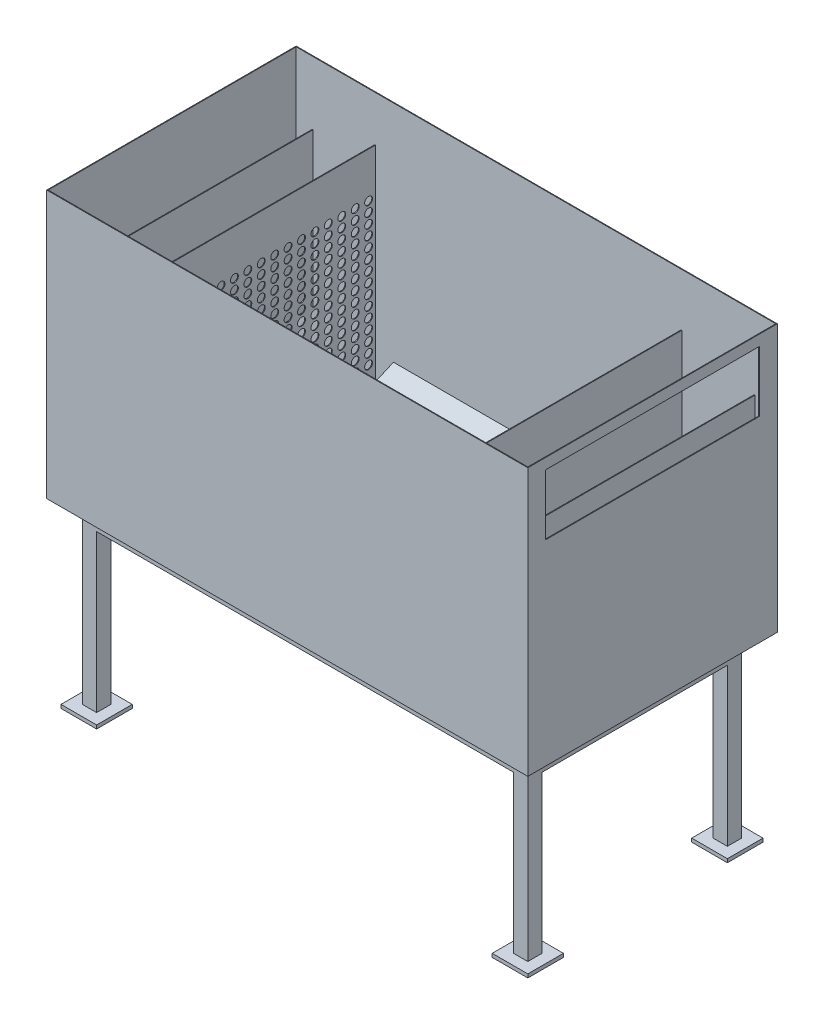
from build123d import *

# Parameters (mm, degrees)
MASTER_FOOTPRINT_W             = 1350
MASTER_FOOTPRINT_H             = 700
BATH_BASE_PLATE_DEPTH          = 750
BATH_SHELL_2MM_T               = -2
SKETCH_1_R                     = 50
INLET_D100_OPENING_DEPTH       = 10
INLET_IMPACT_BAFFLE_START      = 125
SKETCH_2_W                     = 540
SKETCH_2_H                     = 430
INLET_IMPACT_BAFFLE_DEPTH      = 2
DISTRIBUTOR_D22_START          = 250
SKETCH_3_W                     = 640
SKETCH_3_H                     = 648
SKETCH_3_R                     = 11
DISTRIBUTOR_D22_DEPTH          = 2
OUTLET_SUBMERGED_BAFFLE_START  = 1130
SKETCH_4_W                     = 600
SKETCH_4_H                     = 330
OUTLET_SUBMERGED_BAFFLE_DEPTH  = 2
OVERFLOW_WEIR_Z550_START       = 1290
SKETCH_5_W                     = 690
SKETCH_5_H                     = 548
OVERFLOW_WEIR_Z550_DEPTH       = 2
OUTLET_WEIR_SLOT_W600_START    = 1345
SKETCH_6_W                     = 600
SKETCH_6_H                     = 170
OUTLET_WEIR_SLOT_W600_DEPTH    = 10
SLOPED_SEDIMENT_FLOOR_START    = 275
SLOPED_SEDIMENT_FLOOR_DEPTH    = 825
SKETCH_8_W                     = 40
SKETCH_8_H                     = 40
FRAME_LEGS_40X40_H500_DEPTH    = 500
FRAME_LONGITUDINAL_RAILS_START = -20
SKETCH_9_W                     = 1250
SKETCH_9_H                     = 40
FRAME_LONGITUDINAL_RAILS_DEPTH = 40
FRAME_TRANSVERSE_RAILS_START   = -20
SKETCH_10_W                    = 40
SKETCH_10_H                    = 520
FRAME_TRANSVERSE_RAILS_DEPTH   = 40
FRAME_FOOT_PADS_100X100_START  = -500
SKETCH_11_W                    = 100
SKETCH_11_H                    = 100
FRAME_FOOT_PADS_100X100_DEPTH  = 10


with BuildPart() as part:
    # MASTER_FOOTPRINT → BATH_BASE_PLATE (new body)
    with BuildSketch(Plane(origin=(0, 0, 0), x_dir=(1, 0, 0), z_dir=(0, 1, 0))):
        with Locations((675, 350)):
            Rectangle(MASTER_FOOTPRINT_W, MASTER_FOOTPRINT_H)
    extrude(amount=BATH_BASE_PLATE_DEPTH)

    # BATH_SHELL_2MM
    bath_shell_2mm_openings = [part.faces().sort_by_distance(p)[0] for p in [
        (675, 750, -350),
    ]]
    offset(amount=BATH_SHELL_2MM_T, openings=bath_shell_2mm_openings, kind=Kind.INTERSECTION)

    # Эскиз1 → INLET_D100_OPENING (cut)
    with BuildSketch(Plane(origin=(0, 0, 0), x_dir=(0, 0, -1), z_dir=(1, 0, 0))):
        with Locations((350, 420)):
            Circle(SKETCH_1_R)
    extrude(amount=INLET_D100_OPENING_DEPTH, mode=Mode.SUBTRACT)

    # Эскиз6 → OUTLET_WEIR_SLOT_W600 (cut)
    with BuildSketch(Plane(origin=(0, 0, 0), x_dir=(0, 0, -1), z_dir=(1, 0, 0)).offset(OUTLET_WEIR_SLOT_W600_START)):
        with Locations((350, 635)):
            Rectangle(SKETCH_6_W, SKETCH_6_H)
    extrude(amount=OUTLET_WEIR_SLOT_W600_DEPTH, mode=Mode.SUBTRACT)

    # Эскиз7 → SLOPED_SEDIMENT_FLOOR (add)
    with BuildSketch(Plane(origin=(0, 0, 0), x_dir=(0, 0, -1), z_dir=(1, 0, 0)).offset(SLOPED_SEDIMENT_FLOOR_START)):
        Polygon((2, -1), (2, 120), (280, -1), align=None)
        Polygon((698, -1), (698, 120), (420, -1), align=None)
    extrude(amount=SLOPED_SEDIMENT_FLOOR_DEPTH)

    # Эскиз8 → FRAME_LEGS_40X40_H500 (add)
    with BuildSketch(Plane(origin=(0, 0, 0), x_dir=(1, 0, 0), z_dir=(0, 1, 0))):
        with Locations((70, 70)):
            Rectangle(SKETCH_8_W, SKETCH_8_H)
        with Locations((70, 630)):
            Rectangle(SKETCH_8_W, SKETCH_8_H)
        with Locations((1280, 70)):
            Rectangle(SKETCH_8_W, SKETCH_8_H)
        with Locations((1280, 630)):
            Rectangle(SKETCH_8_W, SKETCH_8_H)
    extrude(amount=-FRAME_LEGS_40X40_H500_DEPTH)

    # Эскиз9 → FRAME_LONGITUDINAL_RAILS (add)
    with BuildSketch(Plane(origin=(0, 0, 0), x_dir=(1, 0, 0), z_dir=(0, 1, 0)).offset(FRAME_LONGITUDINAL_RAILS_START)):
        with Locations((675, 70)):
            Rectangle(SKETCH_9_W, SKETCH_9_H)
        with Locations((675, 630)):
            Rectangle(SKETCH_9_W, SKETCH_9_H)
    extrude(amount=-FRAME_LONGITUDINAL_RAILS_DEPTH)

    # Эскиз10 → FRAME_TRANSVERSE_RAILS (add)
    with BuildSketch(Plane(origin=(0, 0, 0), x_dir=(1, 0, 0), z_dir=(0, 1, 0)).offset(FRAME_TRANSVERSE_RAILS_START)):
        with Locations((70, 350)):
            Rectangle(SKETCH_10_W, SKETCH_10_H)
        with Locations((1280, 350)):
            Rectangle(SKETCH_10_W, SKETCH_10_H)
    extrude(amount=-FRAME_TRANSVERSE_RAILS_DEPTH)

    # Эскиз11 → FRAME_FOOT_PADS_100X100 (add)
    with BuildSketch(Plane(origin=(0, 0, 0), x_dir=(1, 0, 0), z_dir=(0, 1, 0)).offset(FRAME_FOOT_PADS_100X100_START)):
        with Locations((70, 70)):
            Rectangle(SKETCH_11_W, SKETCH_11_H)
        with Locations((70, 630)):
            Rectangle(SKETCH_11_W, SKETCH_11_H)
        with Locations((1280, 70)):
            Rectangle(SKETCH_11_W, SKETCH_11_H)
        with Locations((1280, 630)):
            Rectangle(SKETCH_11_W, SKETCH_11_H)
    extrude(amount=-FRAME_FOOT_PADS_100X100_DEPTH)


with BuildPart() as body_2:
    # Эскиз2 → INLET_IMPACT_BAFFLE (new body)
    with BuildSketch(Plane(origin=(0, 0, 0), x_dir=(0, 0, -1), z_dir=(1, 0, 0)).offset(INLET_IMPACT_BAFFLE_START)):
        with Locations((350, 435)):
            Rectangle(SKETCH_2_W, SKETCH_2_H)
    extrude(amount=INLET_IMPACT_BAFFLE_DEPTH)


with BuildPart() as body_3:
    # Эскиз3 → DISTRIBUTOR_D22 (new body)
    with BuildSketch(Plane(origin=(0, 0, 0), x_dir=(0, 0, -1), z_dir=(1, 0, 0)).offset(DISTRIBUTOR_D22_START)):
        with Locations((350, 326)):
            Rectangle(SKETCH_3_W, SKETCH_3_H)
        with Locations((48.823529412, 125)):
            Circle(SKETCH_3_R, mode=Mode.SUBTRACT)
        with Locations((48.823529412, 153.5)):
            Circle(SKETCH_3_R, mode=Mode.SUBTRACT)
        with Locations((48.823529412, 182)):
            Circle(SKETCH_3_R, mode=Mode.SUBTRACT)
        with Locations((48.823529412, 210.5)):
            Circle(SKETCH_3_R, mode=Mode.SUBTRACT)
        with Locations((48.823529412, 239)):
            Circle(SKETCH_3_R, mode=Mode.SUBTRACT)
        with Locations((48.823529412, 267.5)):
            Circle(SKETCH_3_R, mode=Mode.SUBTRACT)
        with Locations((48.823529412, 296)):
            Circle(SKETCH_3_R, mode=Mode.SUBTRACT)
        with Locations((48.823529412, 324.5)):
            Circle(SKETCH_3_R, mode=Mode.SUBTRACT)
        with Locations((48.823529412, 353)):
            Circle(SKETCH_3_R, mode=Mode.SUBTRACT)
        with Locations((48.823529412, 381.5)):
            Circle(SKETCH_3_R, mode=Mode.SUBTRACT)
        with Locations((48.823529412, 410)):
            Circle(SKETCH_3_R, mode=Mode.SUBTRACT)
        with Locations((48.823529412, 438.5)):
            Circle(SKETCH_3_R, mode=Mode.SUBTRACT)
        with Locations((48.823529412, 467)):
            Circle(SKETCH_3_R, mode=Mode.SUBTRACT)
        with Locations((48.823529412, 495.5)):
            Circle(SKETCH_3_R, mode=Mode.SUBTRACT)
        with Locations((48.823529412, 524)):
            Circle(SKETCH_3_R, mode=Mode.SUBTRACT)
        with Locations((86.470588235, 125)):
            Circle(SKETCH_3_R, mode=Mode.SUBTRACT)
        with Locations((86.470588235, 153.5)):
            Circle(SKETCH_3_R, mode=Mode.SUBTRACT)
        with Locations((86.470588235, 182)):
            Circle(SKETCH_3_R, mode=Mode.SUBTRACT)
        with Locations((86.470588235, 210.5)):
            Circle(SKETCH_3_R, mode=Mode.SUBTRACT)
        with Locations((86.470588235, 239)):
            Circle(SKETCH_3_R, mode=Mode.SUBTRACT)
        with Locations((86.470588235, 267.5)):
            Circle(SKETCH_3_R, mode=Mode.SUBTRACT)
        with Locations((86.470588235, 296)):
            Circle(SKETCH_3_R, mode=Mode.SUBTRACT)
        with Locations((86.470588235, 324.5)):
            Circle(SKETCH_3_R, mode=Mode.SUBTRACT)
        with Locations((86.470588235, 353)):
            Circle(SKETCH_3_R, mode=Mode.SUBTRACT)
        with Locations((86.470588235, 381.5)):
            Circle(SKETCH_3_R, mode=Mode.SUBTRACT)
        with Locations((86.470588235, 410)):
            Circle(SKETCH_3_R, mode=Mode.SUBTRACT)
        with Locations((86.470588235, 438.5)):
            Circle(SKETCH_3_R, mode=Mode.SUBTRACT)
        with Locations((86.470588235, 467)):
            Circle(SKETCH_3_R, mode=Mode.SUBTRACT)
        with Locations((86.470588235, 495.5)):
            Circle(SKETCH_3_R, mode=Mode.SUBTRACT)
        with Locations((86.470588235, 524)):
            Circle(SKETCH_3_R, mode=Mode.SUBTRACT)
        with Locations((124.117647059, 125)):
            Circle(SKETCH_3_R, mode=Mode.SUBTRACT)
        with Locations((124.117647059, 153.5)):
            Circle(SKETCH_3_R, mode=Mode.SUBTRACT)
        with Locations((124.117647059, 182)):
            Circle(SKETCH_3_R, mode=Mode.SUBTRACT)
        with Locations((124.117647059, 210.5)):
            Circle(SKETCH_3_R, mode=Mode.SUBTRACT)
        with Locations((124.117647059, 239)):
            Circle(SKETCH_3_R, mode=Mode.SUBTRACT)
        with Locations((124.117647059, 267.5)):
            Circle(SKETCH_3_R, mode=Mode.SUBTRACT)
        with Locations((124.117647059, 296)):
            Circle(SKETCH_3_R, mode=Mode.SUBTRACT)
        with Locations((124.117647059, 324.5)):
            Circle(SKETCH_3_R, mode=Mode.SUBTRACT)
        with Locations((124.117647059, 353)):
            Circle(SKETCH_3_R, mode=Mode.SUBTRACT)
        with Locations((124.117647059, 381.5)):
            Circle(SKETCH_3_R, mode=Mode.SUBTRACT)
        with Locations((124.117647059, 410)):
            Circle(SKETCH_3_R, mode=Mode.SUBTRACT)
        with Locations((124.117647059, 438.5)):
            Circle(SKETCH_3_R, mode=Mode.SUBTRACT)
        with Locations((124.117647059, 467)):
            Circle(SKETCH_3_R, mode=Mode.SUBTRACT)
        with Locations((124.117647059, 495.5)):
            Circle(SKETCH_3_R, mode=Mode.SUBTRACT)
        with Locations((124.117647059, 524)):
            Circle(SKETCH_3_R, mode=Mode.SUBTRACT)
        with Locations((161.764705882, 125)):
            Circle(SKETCH_3_R, mode=Mode.SUBTRACT)
        with Locations((161.764705882, 153.5)):
            Circle(SKETCH_3_R, mode=Mode.SUBTRACT)
        with Locations((161.764705882, 182)):
            Circle(SKETCH_3_R, mode=Mode.SUBTRACT)
        with Locations((161.764705882, 210.5)):
            Circle(SKETCH_3_R, mode=Mode.SUBTRACT)
        with Locations((161.764705882, 239)):
            Circle(SKETCH_3_R, mode=Mode.SUBTRACT)
        with Locations((161.764705882, 267.5)):
            Circle(SKETCH_3_R, mode=Mode.SUBTRACT)
        with Locations((161.764705882, 296)):
            Circle(SKETCH_3_R, mode=Mode.SUBTRACT)
        with Locations((161.764705882, 324.5)):
            Circle(SKETCH_3_R, mode=Mode.SUBTRACT)
        with Locations((161.764705882, 353)):
            Circle(SKETCH_3_R, mode=Mode.SUBTRACT)
        with Locations((161.764705882, 381.5)):
            Circle(SKETCH_3_R, mode=Mode.SUBTRACT)
        with Locations((161.764705882, 410)):
            Circle(SKETCH_3_R, mode=Mode.SUBTRACT)
        with Locations((161.764705882, 438.5)):
            Circle(SKETCH_3_R, mode=Mode.SUBTRACT)
        with Locations((161.764705882, 467)):
            Circle(SKETCH_3_R, mode=Mode.SUBTRACT)
        with Locations((161.764705882, 495.5)):
            Circle(SKETCH_3_R, mode=Mode.SUBTRACT)
        with Locations((161.764705882, 524)):
            Circle(SKETCH_3_R, mode=Mode.SUBTRACT)
        with Locations((199.411764706, 125)):
            Circle(SKETCH_3_R, mode=Mode.SUBTRACT)
        with Locations((199.411764706, 153.5)):
            Circle(SKETCH_3_R, mode=Mode.SUBTRACT)
        with Locations((199.411764706, 182)):
            Circle(SKETCH_3_R, mode=Mode.SUBTRACT)
        with Locations((199.411764706, 210.5)):
            Circle(SKETCH_3_R, mode=Mode.SUBTRACT)
        with Locations((199.411764706, 239)):
            Circle(SKETCH_3_R, mode=Mode.SUBTRACT)
        with Locations((199.411764706, 267.5)):
            Circle(SKETCH_3_R, mode=Mode.SUBTRACT)
        with Locations((199.411764706, 296)):
            Circle(SKETCH_3_R, mode=Mode.SUBTRACT)
        with Locations((199.411764706, 324.5)):
            Circle(SKETCH_3_R, mode=Mode.SUBTRACT)
        with Locations((199.411764706, 353)):
            Circle(SKETCH_3_R, mode=Mode.SUBTRACT)
        with Locations((199.411764706, 381.5)):
            Circle(SKETCH_3_R, mode=Mode.SUBTRACT)
        with Locations((199.411764706, 410)):
            Circle(SKETCH_3_R, mode=Mode.SUBTRACT)
        with Locations((199.411764706, 438.5)):
            Circle(SKETCH_3_R, mode=Mode.SUBTRACT)
        with Locations((199.411764706, 467)):
            Circle(SKETCH_3_R, mode=Mode.SUBTRACT)
        with Locations((199.411764706, 495.5)):
            Circle(SKETCH_3_R, mode=Mode.SUBTRACT)
        with Locations((199.411764706, 524)):
            Circle(SKETCH_3_R, mode=Mode.SUBTRACT)
        with Locations((237.058823529, 125)):
            Circle(SKETCH_3_R, mode=Mode.SUBTRACT)
        with Locations((237.058823529, 153.5)):
            Circle(SKETCH_3_R, mode=Mode.SUBTRACT)
        with Locations((237.058823529, 182)):
            Circle(SKETCH_3_R, mode=Mode.SUBTRACT)
        with Locations((237.058823529, 210.5)):
            Circle(SKETCH_3_R, mode=Mode.SUBTRACT)
        with Locations((237.058823529, 239)):
            Circle(SKETCH_3_R, mode=Mode.SUBTRACT)
        with Locations((237.058823529, 267.5)):
            Circle(SKETCH_3_R, mode=Mode.SUBTRACT)
        with Locations((237.058823529, 296)):
            Circle(SKETCH_3_R, mode=Mode.SUBTRACT)
        with Locations((237.058823529, 324.5)):
            Circle(SKETCH_3_R, mode=Mode.SUBTRACT)
        with Locations((237.058823529, 353)):
            Circle(SKETCH_3_R, mode=Mode.SUBTRACT)
        with Locations((237.058823529, 381.5)):
            Circle(SKETCH_3_R, mode=Mode.SUBTRACT)
        with Locations((237.058823529, 410)):
            Circle(SKETCH_3_R, mode=Mode.SUBTRACT)
        with Locations((237.058823529, 438.5)):
            Circle(SKETCH_3_R, mode=Mode.SUBTRACT)
        with Locations((237.058823529, 467)):
            Circle(SKETCH_3_R, mode=Mode.SUBTRACT)
        with Locations((237.058823529, 495.5)):
            Circle(SKETCH_3_R, mode=Mode.SUBTRACT)
        with Locations((237.058823529, 524)):
            Circle(SKETCH_3_R, mode=Mode.SUBTRACT)
        with Locations((274.705882353, 125)):
            Circle(SKETCH_3_R, mode=Mode.SUBTRACT)
        with Locations((274.705882353, 153.5)):
            Circle(SKETCH_3_R, mode=Mode.SUBTRACT)
        with Locations((274.705882353, 182)):
            Circle(SKETCH_3_R, mode=Mode.SUBTRACT)
        with Locations((274.705882353, 210.5)):
            Circle(SKETCH_3_R, mode=Mode.SUBTRACT)
        with Locations((274.705882353, 239)):
            Circle(SKETCH_3_R, mode=Mode.SUBTRACT)
        with Locations((274.705882353, 267.5)):
            Circle(SKETCH_3_R, mode=Mode.SUBTRACT)
        with Locations((274.705882353, 296)):
            Circle(SKETCH_3_R, mode=Mode.SUBTRACT)
        with Locations((274.705882353, 324.5)):
            Circle(SKETCH_3_R, mode=Mode.SUBTRACT)
        with Locations((274.705882353, 353)):
            Circle(SKETCH_3_R, mode=Mode.SUBTRACT)
        with Locations((274.705882353, 381.5)):
            Circle(SKETCH_3_R, mode=Mode.SUBTRACT)
        with Locations((274.705882353, 410)):
            Circle(SKETCH_3_R, mode=Mode.SUBTRACT)
        with Locations((274.705882353, 438.5)):
            Circle(SKETCH_3_R, mode=Mode.SUBTRACT)
        with Locations((274.705882353, 467)):
            Circle(SKETCH_3_R, mode=Mode.SUBTRACT)
        with Locations((274.705882353, 495.5)):
            Circle(SKETCH_3_R, mode=Mode.SUBTRACT)
        with Locations((274.705882353, 524)):
            Circle(SKETCH_3_R, mode=Mode.SUBTRACT)
        with Locations((312.352941176, 125)):
            Circle(SKETCH_3_R, mode=Mode.SUBTRACT)
        with Locations((312.352941176, 153.5)):
            Circle(SKETCH_3_R, mode=Mode.SUBTRACT)
        with Locations((312.352941176, 182)):
            Circle(SKETCH_3_R, mode=Mode.SUBTRACT)
        with Locations((312.352941176, 210.5)):
            Circle(SKETCH_3_R, mode=Mode.SUBTRACT)
        with Locations((312.352941176, 239)):
            Circle(SKETCH_3_R, mode=Mode.SUBTRACT)
        with Locations((312.352941176, 267.5)):
            Circle(SKETCH_3_R, mode=Mode.SUBTRACT)
        with Locations((312.352941176, 296)):
            Circle(SKETCH_3_R, mode=Mode.SUBTRACT)
        with Locations((312.352941176, 324.5)):
            Circle(SKETCH_3_R, mode=Mode.SUBTRACT)
        with Locations((312.352941176, 353)):
            Circle(SKETCH_3_R, mode=Mode.SUBTRACT)
        with Locations((312.352941176, 381.5)):
            Circle(SKETCH_3_R, mode=Mode.SUBTRACT)
        with Locations((312.352941176, 410)):
            Circle(SKETCH_3_R, mode=Mode.SUBTRACT)
        with Locations((312.352941176, 438.5)):
            Circle(SKETCH_3_R, mode=Mode.SUBTRACT)
        with Locations((312.352941176, 467)):
            Circle(SKETCH_3_R, mode=Mode.SUBTRACT)
        with Locations((312.352941176, 495.5)):
            Circle(SKETCH_3_R, mode=Mode.SUBTRACT)
        with Locations((312.352941176, 524)):
            Circle(SKETCH_3_R, mode=Mode.SUBTRACT)
        with Locations((350, 125)):
            Circle(SKETCH_3_R, mode=Mode.SUBTRACT)
        with Locations((350, 153.5)):
            Circle(SKETCH_3_R, mode=Mode.SUBTRACT)
        with Locations((350, 182)):
            Circle(SKETCH_3_R, mode=Mode.SUBTRACT)
        with Locations((350, 210.5)):
            Circle(SKETCH_3_R, mode=Mode.SUBTRACT)
        with Locations((350, 239)):
            Circle(SKETCH_3_R, mode=Mode.SUBTRACT)
        with Locations((350, 267.5)):
            Circle(SKETCH_3_R, mode=Mode.SUBTRACT)
        with Locations((350, 296)):
            Circle(SKETCH_3_R, mode=Mode.SUBTRACT)
        with Locations((350, 324.5)):
            Circle(SKETCH_3_R, mode=Mode.SUBTRACT)
        with Locations((350, 353)):
            Circle(SKETCH_3_R, mode=Mode.SUBTRACT)
        with Locations((350, 381.5)):
            Circle(SKETCH_3_R, mode=Mode.SUBTRACT)
        with Locations((350, 410)):
            Circle(SKETCH_3_R, mode=Mode.SUBTRACT)
        with Locations((350, 438.5)):
            Circle(SKETCH_3_R, mode=Mode.SUBTRACT)
        with Locations((350, 467)):
            Circle(SKETCH_3_R, mode=Mode.SUBTRACT)
        with Locations((350, 495.5)):
            Circle(SKETCH_3_R, mode=Mode.SUBTRACT)
        with Locations((350, 524)):
            Circle(SKETCH_3_R, mode=Mode.SUBTRACT)
        with Locations((387.647058824, 125)):
            Circle(SKETCH_3_R, mode=Mode.SUBTRACT)
        with Locations((387.647058824, 153.5)):
            Circle(SKETCH_3_R, mode=Mode.SUBTRACT)
        with Locations((387.647058824, 182)):
            Circle(SKETCH_3_R, mode=Mode.SUBTRACT)
        with Locations((387.647058824, 210.5)):
            Circle(SKETCH_3_R, mode=Mode.SUBTRACT)
        with Locations((387.647058824, 239)):
            Circle(SKETCH_3_R, mode=Mode.SUBTRACT)
        with Locations((387.647058824, 267.5)):
            Circle(SKETCH_3_R, mode=Mode.SUBTRACT)
        with Locations((387.647058824, 296)):
            Circle(SKETCH_3_R, mode=Mode.SUBTRACT)
        with Locations((387.647058824, 324.5)):
            Circle(SKETCH_3_R, mode=Mode.SUBTRACT)
        with Locations((387.647058824, 353)):
            Circle(SKETCH_3_R, mode=Mode.SUBTRACT)
        with Locations((387.647058824, 381.5)):
            Circle(SKETCH_3_R, mode=Mode.SUBTRACT)
        with Locations((387.647058824, 410)):
            Circle(SKETCH_3_R, mode=Mode.SUBTRACT)
        with Locations((387.647058824, 438.5)):
            Circle(SKETCH_3_R, mode=Mode.SUBTRACT)
        with Locations((387.647058824, 467)):
            Circle(SKETCH_3_R, mode=Mode.SUBTRACT)
        with Locations((387.647058824, 495.5)):
            Circle(SKETCH_3_R, mode=Mode.SUBTRACT)
        with Locations((387.647058824, 524)):
            Circle(SKETCH_3_R, mode=Mode.SUBTRACT)
        with Locations((425.294117647, 125)):
            Circle(SKETCH_3_R, mode=Mode.SUBTRACT)
        with Locations((425.294117647, 153.5)):
            Circle(SKETCH_3_R, mode=Mode.SUBTRACT)
        with Locations((425.294117647, 182)):
            Circle(SKETCH_3_R, mode=Mode.SUBTRACT)
        with Locations((425.294117647, 210.5)):
            Circle(SKETCH_3_R, mode=Mode.SUBTRACT)
        with Locations((425.294117647, 239)):
            Circle(SKETCH_3_R, mode=Mode.SUBTRACT)
        with Locations((425.294117647, 267.5)):
            Circle(SKETCH_3_R, mode=Mode.SUBTRACT)
        with Locations((425.294117647, 296)):
            Circle(SKETCH_3_R, mode=Mode.SUBTRACT)
        with Locations((425.294117647, 324.5)):
            Circle(SKETCH_3_R, mode=Mode.SUBTRACT)
        with Locations((425.294117647, 353)):
            Circle(SKETCH_3_R, mode=Mode.SUBTRACT)
        with Locations((425.294117647, 381.5)):
            Circle(SKETCH_3_R, mode=Mode.SUBTRACT)
        with Locations((425.294117647, 410)):
            Circle(SKETCH_3_R, mode=Mode.SUBTRACT)
        with Locations((425.294117647, 438.5)):
            Circle(SKETCH_3_R, mode=Mode.SUBTRACT)
        with Locations((425.294117647, 467)):
            Circle(SKETCH_3_R, mode=Mode.SUBTRACT)
        with Locations((425.294117647, 495.5)):
            Circle(SKETCH_3_R, mode=Mode.SUBTRACT)
        with Locations((425.294117647, 524)):
            Circle(SKETCH_3_R, mode=Mode.SUBTRACT)
        with Locations((462.941176471, 125)):
            Circle(SKETCH_3_R, mode=Mode.SUBTRACT)
        with Locations((462.941176471, 153.5)):
            Circle(SKETCH_3_R, mode=Mode.SUBTRACT)
        with Locations((462.941176471, 182)):
            Circle(SKETCH_3_R, mode=Mode.SUBTRACT)
        with Locations((462.941176471, 210.5)):
            Circle(SKETCH_3_R, mode=Mode.SUBTRACT)
        with Locations((462.941176471, 239)):
            Circle(SKETCH_3_R, mode=Mode.SUBTRACT)
        with Locations((462.941176471, 267.5)):
            Circle(SKETCH_3_R, mode=Mode.SUBTRACT)
        with Locations((462.941176471, 296)):
            Circle(SKETCH_3_R, mode=Mode.SUBTRACT)
        with Locations((462.941176471, 324.5)):
            Circle(SKETCH_3_R, mode=Mode.SUBTRACT)
        with Locations((462.941176471, 353)):
            Circle(SKETCH_3_R, mode=Mode.SUBTRACT)
        with Locations((462.941176471, 381.5)):
            Circle(SKETCH_3_R, mode=Mode.SUBTRACT)
        with Locations((462.941176471, 410)):
            Circle(SKETCH_3_R, mode=Mode.SUBTRACT)
        with Locations((462.941176471, 438.5)):
            Circle(SKETCH_3_R, mode=Mode.SUBTRACT)
        with Locations((462.941176471, 467)):
            Circle(SKETCH_3_R, mode=Mode.SUBTRACT)
        with Locations((462.941176471, 495.5)):
            Circle(SKETCH_3_R, mode=Mode.SUBTRACT)
        with Locations((462.941176471, 524)):
            Circle(SKETCH_3_R, mode=Mode.SUBTRACT)
        with Locations((500.588235294, 125)):
            Circle(SKETCH_3_R, mode=Mode.SUBTRACT)
        with Locations((500.588235294, 153.5)):
            Circle(SKETCH_3_R, mode=Mode.SUBTRACT)
        with Locations((500.588235294, 182)):
            Circle(SKETCH_3_R, mode=Mode.SUBTRACT)
        with Locations((500.588235294, 210.5)):
            Circle(SKETCH_3_R, mode=Mode.SUBTRACT)
        with Locations((500.588235294, 239)):
            Circle(SKETCH_3_R, mode=Mode.SUBTRACT)
        with Locations((500.588235294, 267.5)):
            Circle(SKETCH_3_R, mode=Mode.SUBTRACT)
        with Locations((500.588235294, 296)):
            Circle(SKETCH_3_R, mode=Mode.SUBTRACT)
        with Locations((500.588235294, 324.5)):
            Circle(SKETCH_3_R, mode=Mode.SUBTRACT)
        with Locations((500.588235294, 353)):
            Circle(SKETCH_3_R, mode=Mode.SUBTRACT)
        with Locations((500.588235294, 381.5)):
            Circle(SKETCH_3_R, mode=Mode.SUBTRACT)
        with Locations((500.588235294, 410)):
            Circle(SKETCH_3_R, mode=Mode.SUBTRACT)
        with Locations((500.588235294, 438.5)):
            Circle(SKETCH_3_R, mode=Mode.SUBTRACT)
        with Locations((500.588235294, 467)):
            Circle(SKETCH_3_R, mode=Mode.SUBTRACT)
        with Locations((500.588235294, 495.5)):
            Circle(SKETCH_3_R, mode=Mode.SUBTRACT)
        with Locations((500.588235294, 524)):
            Circle(SKETCH_3_R, mode=Mode.SUBTRACT)
        with Locations((538.235294118, 125)):
            Circle(SKETCH_3_R, mode=Mode.SUBTRACT)
        with Locations((538.235294118, 153.5)):
            Circle(SKETCH_3_R, mode=Mode.SUBTRACT)
        with Locations((538.235294118, 182)):
            Circle(SKETCH_3_R, mode=Mode.SUBTRACT)
        with Locations((538.235294118, 210.5)):
            Circle(SKETCH_3_R, mode=Mode.SUBTRACT)
        with Locations((538.235294118, 239)):
            Circle(SKETCH_3_R, mode=Mode.SUBTRACT)
        with Locations((538.235294118, 267.5)):
            Circle(SKETCH_3_R, mode=Mode.SUBTRACT)
        with Locations((538.235294118, 296)):
            Circle(SKETCH_3_R, mode=Mode.SUBTRACT)
        with Locations((538.235294118, 324.5)):
            Circle(SKETCH_3_R, mode=Mode.SUBTRACT)
        with Locations((538.235294118, 353)):
            Circle(SKETCH_3_R, mode=Mode.SUBTRACT)
        with Locations((538.235294118, 381.5)):
            Circle(SKETCH_3_R, mode=Mode.SUBTRACT)
        with Locations((538.235294118, 410)):
            Circle(SKETCH_3_R, mode=Mode.SUBTRACT)
        with Locations((538.235294118, 438.5)):
            Circle(SKETCH_3_R, mode=Mode.SUBTRACT)
        with Locations((538.235294118, 467)):
            Circle(SKETCH_3_R, mode=Mode.SUBTRACT)
        with Locations((538.235294118, 495.5)):
            Circle(SKETCH_3_R, mode=Mode.SUBTRACT)
        with Locations((538.235294118, 524)):
            Circle(SKETCH_3_R, mode=Mode.SUBTRACT)
        with Locations((575.882352941, 125)):
            Circle(SKETCH_3_R, mode=Mode.SUBTRACT)
        with Locations((575.882352941, 153.5)):
            Circle(SKETCH_3_R, mode=Mode.SUBTRACT)
        with Locations((575.882352941, 182)):
            Circle(SKETCH_3_R, mode=Mode.SUBTRACT)
        with Locations((575.882352941, 210.5)):
            Circle(SKETCH_3_R, mode=Mode.SUBTRACT)
        with Locations((575.882352941, 239)):
            Circle(SKETCH_3_R, mode=Mode.SUBTRACT)
        with Locations((575.882352941, 267.5)):
            Circle(SKETCH_3_R, mode=Mode.SUBTRACT)
        with Locations((575.882352941, 296)):
            Circle(SKETCH_3_R, mode=Mode.SUBTRACT)
        with Locations((575.882352941, 324.5)):
            Circle(SKETCH_3_R, mode=Mode.SUBTRACT)
        with Locations((575.882352941, 353)):
            Circle(SKETCH_3_R, mode=Mode.SUBTRACT)
        with Locations((575.882352941, 381.5)):
            Circle(SKETCH_3_R, mode=Mode.SUBTRACT)
        with Locations((575.882352941, 410)):
            Circle(SKETCH_3_R, mode=Mode.SUBTRACT)
        with Locations((575.882352941, 438.5)):
            Circle(SKETCH_3_R, mode=Mode.SUBTRACT)
        with Locations((575.882352941, 467)):
            Circle(SKETCH_3_R, mode=Mode.SUBTRACT)
        with Locations((575.882352941, 495.5)):
            Circle(SKETCH_3_R, mode=Mode.SUBTRACT)
        with Locations((575.882352941, 524)):
            Circle(SKETCH_3_R, mode=Mode.SUBTRACT)
        with Locations((613.529411765, 125)):
            Circle(SKETCH_3_R, mode=Mode.SUBTRACT)
        with Locations((613.529411765, 153.5)):
            Circle(SKETCH_3_R, mode=Mode.SUBTRACT)
        with Locations((613.529411765, 182)):
            Circle(SKETCH_3_R, mode=Mode.SUBTRACT)
        with Locations((613.529411765, 210.5)):
            Circle(SKETCH_3_R, mode=Mode.SUBTRACT)
        with Locations((613.529411765, 239)):
            Circle(SKETCH_3_R, mode=Mode.SUBTRACT)
        with Locations((613.529411765, 267.5)):
            Circle(SKETCH_3_R, mode=Mode.SUBTRACT)
        with Locations((613.529411765, 296)):
            Circle(SKETCH_3_R, mode=Mode.SUBTRACT)
        with Locations((613.529411765, 324.5)):
            Circle(SKETCH_3_R, mode=Mode.SUBTRACT)
        with Locations((613.529411765, 353)):
            Circle(SKETCH_3_R, mode=Mode.SUBTRACT)
        with Locations((613.529411765, 381.5)):
            Circle(SKETCH_3_R, mode=Mode.SUBTRACT)
        with Locations((613.529411765, 410)):
            Circle(SKETCH_3_R, mode=Mode.SUBTRACT)
        with Locations((613.529411765, 438.5)):
            Circle(SKETCH_3_R, mode=Mode.SUBTRACT)
        with Locations((613.529411765, 467)):
            Circle(SKETCH_3_R, mode=Mode.SUBTRACT)
        with Locations((613.529411765, 495.5)):
            Circle(SKETCH_3_R, mode=Mode.SUBTRACT)
        with Locations((613.529411765, 524)):
            Circle(SKETCH_3_R, mode=Mode.SUBTRACT)
        with Locations((651.176470588, 125)):
            Circle(SKETCH_3_R, mode=Mode.SUBTRACT)
        with Locations((651.176470588, 153.5)):
            Circle(SKETCH_3_R, mode=Mode.SUBTRACT)
        with Locations((651.176470588, 182)):
            Circle(SKETCH_3_R, mode=Mode.SUBTRACT)
        with Locations((651.176470588, 210.5)):
            Circle(SKETCH_3_R, mode=Mode.SUBTRACT)
        with Locations((651.176470588, 239)):
            Circle(SKETCH_3_R, mode=Mode.SUBTRACT)
        with Locations((651.176470588, 267.5)):
            Circle(SKETCH_3_R, mode=Mode.SUBTRACT)
        with Locations((651.176470588, 296)):
            Circle(SKETCH_3_R, mode=Mode.SUBTRACT)
        with Locations((651.176470588, 324.5)):
            Circle(SKETCH_3_R, mode=Mode.SUBTRACT)
        with Locations((651.176470588, 353)):
            Circle(SKETCH_3_R, mode=Mode.SUBTRACT)
        with Locations((651.176470588, 381.5)):
            Circle(SKETCH_3_R, mode=Mode.SUBTRACT)
        with Locations((651.176470588, 410)):
            Circle(SKETCH_3_R, mode=Mode.SUBTRACT)
        with Locations((651.176470588, 438.5)):
            Circle(SKETCH_3_R, mode=Mode.SUBTRACT)
        with Locations((651.176470588, 467)):
            Circle(SKETCH_3_R, mode=Mode.SUBTRACT)
        with Locations((651.176470588, 495.5)):
            Circle(SKETCH_3_R, mode=Mode.SUBTRACT)
        with Locations((651.176470588, 524)):
            Circle(SKETCH_3_R, mode=Mode.SUBTRACT)
    extrude(amount=DISTRIBUTOR_D22_DEPTH)


with BuildPart() as body_4:
    # Эскиз4 → OUTLET_SUBMERGED_BAFFLE (new body)
    with BuildSketch(Plane(origin=(0, 0, 0), x_dir=(0, 0, -1), z_dir=(1, 0, 0)).offset(OUTLET_SUBMERGED_BAFFLE_START)):
        with Locations((350, 485)):
            Rectangle(SKETCH_4_W, SKETCH_4_H)
    extrude(amount=OUTLET_SUBMERGED_BAFFLE_DEPTH)


with BuildPart() as body_5:
    # Эскиз5 → OVERFLOW_WEIR_Z550 (new body)
    with BuildSketch(Plane(origin=(0, 0, 0), x_dir=(0, 0, -1), z_dir=(1, 0, 0)).offset(OVERFLOW_WEIR_Z550_START)):
        with Locations((350, 276)):
            Rectangle(SKETCH_5_W, SKETCH_5_H)
    extrude(amount=OVERFLOW_WEIR_Z550_DEPTH)


solid = Compound([part.part, body_2.part, body_3.part, body_4.part, body_5.part])
